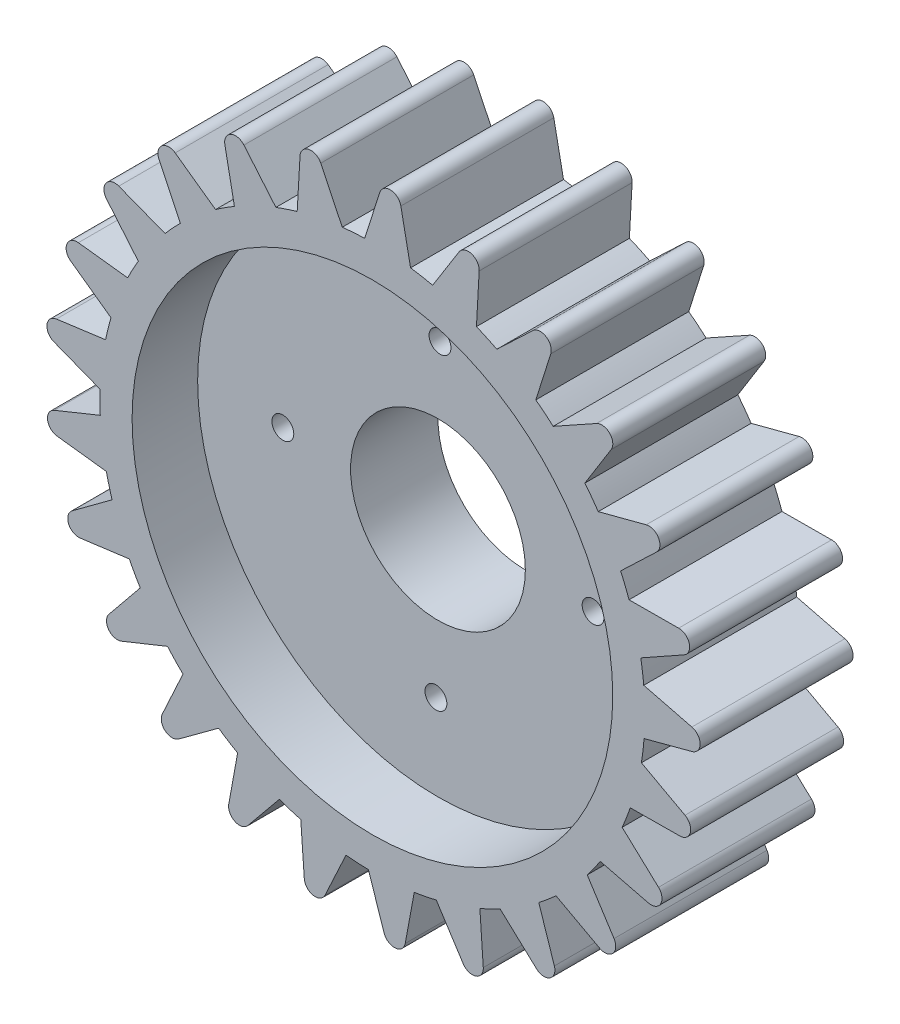
from build123d import *
from build123d.topology import SkipClean

# Parameters (mm, degrees)
BOSS_EXTRU_1_START       = -4.5
BOSS_EXTRU_1_OUTLINE_R   = 0.5
BOSS_EXTRU_1_DEPTH       = 4.5
BOSS_EXTRU_1_START_2     = -7
BOSS_EXTRU_1_2_OUTLINE_R = 10.25
BOSS_EXTRU_1_2_DEPTH     = 2.5
ESQUISSE4_R              = 10.25
BOSS_EXTRU_3_DEPTH       = 3
ESQUISSE5_R              = 11
ENL_V_MAT_EXTRU_2_DEPTH  = 3
ESQUISSE6_R              = 4
ENL_V_MAT_EXTRU_3_DEPTH  = 43.121787281
ESQUISSE7_R              = 0.5
ENL_V_MAT_EXTRU_4_DEPTH  = 43.121787281


with BuildPart() as part:
    # Boss.-Extru.1: read off the stored shape, not the designer's step
    # Boss.-Extru.1 outline → Boss.-Extru.1 (new body)
    with BuildSketch(Plane.XY.offset(81.1).offset(BOSS_EXTRU_1_START)):
        with BuildLine():
            Line((-3.909244984, 5.703911435), (-5.573417888, 7.249599077))
            ThreePointArc((-5.573417888, 7.249599077), (-5.377699975, 7.724704854), (-5.201720804, 8.207470152))
            Line((-5.201720804, 8.207470152), (-2.930536955, 8.226062269))
            ThreePointArc((-2.930536955, 8.226062269), (-2.449499938, 8.605012647), (-2.696157809, 9.16551233))
            Line((-2.696157809, 9.16551233), (-4.692444547, 10.24877638))
            ThreePointArc((-4.692444547, 10.24877638), (-4.621029474, 10.757628902), (-4.570637859, 11.26899148))
            Line((-4.570637859, 11.26899148), (-2.375431099, 11.851819947))
            ThreePointArc((-2.375431099, 11.851819947), (-2.003747871, 12.338493943), (-2.382047135, 12.820043179))
            Line((-2.382047135, 12.820043179), (-4.585013668, 13.372818174))
            ThreePointArc((-4.585013668, 13.372818174), (-4.642388707, 13.883444364), (-4.72075094, 14.391273432))
            Line((-4.72075094, 14.391273432), (-2.739454182, 15.501716992))
            ThreePointArc((-2.739454182, 15.501716992), (-2.500478968, 16.065535089), (-2.986649689, 16.43787637))
            Line((-2.986649689, 16.43787637), (-5.257875529, 16.425429423))
            ThreePointArc((-5.257875529, 16.425429423), (-5.440435595, 16.905744761), (-5.642627888, 17.378131549))
            Line((-5.642627888, 17.378131549), (-3.999733295, 18.94641695))
            ThreePointArc((-3.999733295, 18.94641695), (-3.908481786, 19.551952384), (-4.471976071, 19.791690138))
            Line((-4.471976071, 19.791690138), (-6.668751745, 19.214803336))
            ThreePointArc((-6.668751745, 19.214803336), (-6.965025918, 19.634627842), (-7.278343785, 20.041890553))
            Line((-7.278343785, 20.041890553), (-6.077080467, 21.969476655))
            ThreePointArc((-6.077080467, 21.969476655), (-6.139286329, 22.578681408), (-6.744697761, 22.670752028))
            Line((-6.744697761, 22.670752028), (-8.728991773, 21.565673292))
            ThreePointArc((-8.728991773, 21.565673292), (-9.120364058, 21.898627848), (-9.525120585, 22.215176667))
            Line((-9.525120585, 22.215176667), (-8.840968333, 24.380946146))
            ThreePointArc((-8.840968333, 24.380946146), (-9.052722946, 24.955541642), (-9.662011296, 24.894159994))
            Line((-9.662011296, 24.894159994), (-11.309143157, 23.330325485))
            ThreePointArc((-11.309143157, 23.330325485), (-11.771022192, 23.555489332), (-12.241785039, 23.761434332))
            Line((-12.241785039, 23.761434332), (-12.117731656, 26.029303927))
            ThreePointArc((-12.117731656, 26.029303927), (-12.465729697, 26.533186219), (-13.040611138, 26.322209137))
            Line((-13.040611138, 26.322209137), (-14.247085495, 24.397880327))
            ThreePointArc((-14.247085495, 24.397880327), (-14.750449723, 24.501105593), (-15.257639128, 24.583506493))
            Line((-15.257639128, 24.583506493), (-15.701479344, 26.810977617))
            ThreePointArc((-15.701479344, 26.810977617), (-16.163854817, 27.212485926), (-16.668207433, 26.865169876))
            Line((-16.668207433, 26.865169876), (-17.358217065, 24.701259423))
            ThreePointArc((-17.358217065, 24.701259423), (-17.87143826, 24.676060085), (-18.383185648, 24.629739333))
            Line((-18.383185648, 24.629739333), (-19.367031349, 26.676851782))
            ThreePointArc((-19.367031349, 26.676851782), (-19.914731503, 26.950757865), (-20.316864965, 26.488925992))
            Line((-20.316864965, 26.488925992), (-20.44705403, 24.221400348))
            ThreePointArc((-20.44705403, 24.221400348), (-20.937884616, 24.069359772), (-21.422035016, 23.897227871))
            Line((-21.422035016, 23.897227871), (-22.88406756, 25.635354042))
            ThreePointArc((-22.88406756, 25.635354042), (-23.482678378, 25.764447372), (-23.757325162, 25.217118272))
            Line((-23.757325162, 25.217118272), (-23.319513401, 22.988454411))
            ThreePointArc((-23.319513401, 22.988454411), (-23.757112689, 22.719125866), (-24.183245151, 22.431998497))
            Line((-24.183245151, 22.431998497), (-26.031599654, 23.75192553))
            ThreePointArc((-26.031599654, 23.75192553), (-26.643508219, 23.728094699), (-26.773411257, 23.129659071))
            Line((-26.773411257, 23.129659071), (-25.795107994, 21.079892141))
            ThreePointArc((-25.795107994, 21.079892141), (-26.15198001, 20.71019853), (-26.493319064, 20.326116962))
            Line((-26.493319064, 20.326116962), (-28.611856617, 21.144908987))
            ThreePointArc((-28.611856617, 21.144908987), (-29.198614462, 20.969651373), (-29.175611469, 20.357711129))
            Line((-29.175611469, 20.357711129), (-27.718287094, 18.615635525))
            ThreePointArc((-27.718287094, 18.615635525), (-27.972008257, 18.168806058), (-28.207106316, 17.711903547))
            Line((-28.207106316, 17.711903547), (-30.462711412, 17.97811285))
            ThreePointArc((-30.462711412, 17.97811285), (-30.987450384, 17.662440534), (-30.812986722, 17.07544613))
            Line((-30.812986722, 17.07544613), (-28.968210287, 15.750522868))
            ThreePointArc((-28.968210287, 15.750522868), (-29.102838363, 15.254633483), (-29.21692335, 14.753618895))
            Line((-29.21692335, 14.753618895), (-31.467868026, 14.450518566))
            ThreePointArc((-31.467868026, 14.450518566), (-31.897616846, 14.014266401), (-31.582654708, 13.489100854))
            Line((-31.582654708, 13.489100854), (-29.466340301, 12.664579737))
            ThreePointArc((-29.466340301, 12.664579737), (-29.473416113, 12.150788987), (-29.459319649, 11.637142911))
            Line((-29.459319649, 11.637142911), (-31.564168772, 10.783777859))
            ThreePointArc((-31.564168772, 10.783777859), (-31.871924741, 10.254357173), (-31.436254358, 9.824018565))
            Line((-31.436254358, 9.824018565), (-29.181377796, 9.551707286))
            ThreePointArc((-29.181377796, 9.551707286), (-29.060456745, 9.052298535), (-28.919064562, 8.558295243))
            Line((-28.919064562, 8.558295243), (-30.745562721, 7.208285533))
            ThreePointArc((-30.745562721, 7.208285533), (-30.923950166, 6.651851669), (-30.4528061, 6.30621603))
            ThreePointArc((-30.4528061, 6.30621603), (-30.417820488, 6.307130406), (-30.382984542, 6.310489863))
            Line((-30.382984542, 6.310489863), (-28.131228013, 6.607498741))
            ThreePointArc((-28.131228013, 6.607498741), (-27.889908013, 6.153851677), (-27.630104303, 5.710531213))
            Line((-27.630104303, 5.710531213), (-29.063485901, 3.948702919))
            ThreePointArc((-29.063485901, 3.948702919), (-29.128120108, 3.420421463), (-28.68007066, 3.133174933))
            ThreePointArc((-28.68007066, 3.133174933), (-28.582776383, 3.141853299), (-28.489026078, 3.169282677))
            Line((-28.489026078, 3.169282677), (-26.381875725, 4.016949552))
            ThreePointArc((-26.381875725, 4.016949552), (-26.0353198, 3.637568488), (-25.673428985, 3.272786307))
            Line((-25.673428985, 3.272786307), (-26.623629384, 1.209841581))
            ThreePointArc((-26.623629384, 1.209841581), (-26.591744573, 0.732894494), (-26.173925731, 0.500682133))
            ThreePointArc((-26.173925731, 0.500682133), (-26.015787197, 0.524872616), (-25.873383342, 0.597770608))
            Line((-25.873383342, 0.597770608), (-24.043239171, 1.942833453))
            ThreePointArc((-24.043239171, 1.942833453), (-23.613222703, 1.661556297), (-23.171983715, 1.398233005))
            Line((-23.171983715, 1.398233005), (-23.57929833, -0.83620575))
            ThreePointArc((-23.57929833, -0.83620575), (-23.472770619, -1.244452113), (-23.091841616, -1.425853165))
            ThreePointArc((-23.091841616, -1.425853165), (-22.875282785, -1.378647076), (-22.700406786, -1.242468784))
            Line((-22.700406786, -1.242468784), (-21.262263487, 0.515474786))
            ThreePointArc((-21.262263487, 0.515474786), (-20.775805993, 0.349975216), (-20.282943498, 0.204656383))
            Line((-20.282943498, 0.204656383), (-20.121779254, -2.060878394))
            ThreePointArc((-20.121779254, -2.060878394), (-19.965438701, -2.389765735), (-19.627476996, -2.525379664))
            ThreePointArc((-19.627476996, -2.525379664), (-19.355843148, -2.448017449), (-19.169466196, -2.235806489))
            Line((-19.169466196, -2.235806489), (-18.213687601, -0.175440255))
            ThreePointArc((-18.213687601, -0.175440255), (-17.701354994, -0.214763292), (-17.187837357, -0.232946748))
            Line((-17.187837357, -0.232946748), (-16.468320796, -2.387225667))
            ThreePointArc((-16.468320796, -2.387225667), (-16.288105208, -2.633236988), (-15.998510639, -2.728810069))
            ThreePointArc((-15.998510639, -2.728810069), (-15.676015623, -2.614626788), (-15.502423555, -2.319827447))
            Line((-15.502423555, -2.319827447), (-15.089064749, -0.086498936))
            ThreePointArc((-15.089064749, -0.086498936), (-14.583048771, 0.00282537), (-14.081142194, 0.112919824))
            Line((-14.081142194, 0.112919824), (-12.848483188, -1.794741969))
            ThreePointArc((-12.848483188, -1.794741969), (-12.669554224, -1.961452124), (-12.43296385, -2.0233621))
            ThreePointArc((-12.43296385, -2.0233621), (-12.064623624, -1.866273504), (-11.92969264, -1.489252312))
            Line((-11.92969264, -1.489252312), (-12.084726477, 0.776710232))
            ThreePointArc((-12.084726477, 0.776710232), (-11.616821973, 0.989069307), (-11.158063091, 1.220524032))
            Line((-11.158063091, 1.220524032), (-9.489714138, -0.320655229))
            ThreePointArc((-9.489714138, -0.320655229), (-9.334658071, -0.418206145), (-9.154873045, -0.453361648))
            ThreePointArc((-9.154873045, -0.453361648), (-8.746426575, -0.247960128), (-8.675761274, 0.203730826))
            Line((-8.675761274, 0.203730826), (-9.389446406, 2.359948643))
            ThreePointArc((-9.389446406, 2.359948643), (-8.989053537, 2.681999186), (-8.602267858, 3.020271029))
            Line((-8.602267858, 3.020271029), (-6.603057459, 1.942412262))
            ThreePointArc((-6.603057459, 1.942412262), (-6.490287107, 1.89827398), (-6.370212726, 1.882542386))
            ThreePointArc((-6.370212726, 1.882542386), (-5.928031476, 2.140902511), (-5.94508593, 2.65274561))
            Line((-5.94508593, 2.65274561), (-7.172578897, 4.563735604))
            ThreePointArc((-7.172578897, 4.563735604), (-6.86485582, 4.975241994), (-6.574346511, 5.399076092))
            Line((-6.574346511, 5.399076092), (-4.369892407, 4.852263649))
            ThreePointArc((-4.369892407, 4.852263649), (-4.312353454, 4.841521136), (-4.253953343, 4.83757656))
            ThreePointArc((-4.253953343, 4.83757656), (-3.784940794, 5.152705785), (-3.909244984, 5.703911435))
        make_face()
        with Locations((-17.096499658, 5.136609209)):
            Circle(BOSS_EXTRU_1_OUTLINE_R, mode=Mode.SUBTRACT)
        with BuildLine():
            ThreePointArc((-16.967898566, 16.235841236), (-13.003555219, 12.200499637), (-17.038896818, 8.236156289))
            ThreePointArc((-17.038896818, 8.236156289), (-21.003240165, 12.271497888), (-16.967898566, 16.235841236))
        make_face(mode=Mode.SUBTRACT)
        with Locations((-9.904008139, 12.142896796)):
            Circle(BOSS_EXTRU_1_OUTLINE_R, mode=Mode.SUBTRACT)
        with Locations((-24.102787245, 12.329100728)):
            Circle(BOSS_EXTRU_1_OUTLINE_R, mode=Mode.SUBTRACT)
        with Locations((-16.910295726, 19.335388315)):
            Circle(BOSS_EXTRU_1_OUTLINE_R, mode=Mode.SUBTRACT)
    extrude(amount=BOSS_EXTRU_1_DEPTH)

    # Boss.-Extru.1 2 outline → Boss.-Extru.1 2 (add)
    with BuildSketch(Plane.XY.offset(81.1).offset(BOSS_EXTRU_1_START_2)):
        with BuildLine():
            Line((-3.909244984, 5.703911435), (-5.573417888, 7.249599077))
            ThreePointArc((-5.573417888, 7.249599077), (-5.377699975, 7.724704854), (-5.201720804, 8.207470152))
            Line((-5.201720804, 8.207470152), (-2.930536955, 8.226062269))
            ThreePointArc((-2.930536955, 8.226062269), (-2.449499938, 8.605012647), (-2.696157809, 9.16551233))
            Line((-2.696157809, 9.16551233), (-4.692444547, 10.24877638))
            ThreePointArc((-4.692444547, 10.24877638), (-4.621029474, 10.757628902), (-4.570637859, 11.26899148))
            Line((-4.570637859, 11.26899148), (-2.375431099, 11.851819947))
            ThreePointArc((-2.375431099, 11.851819947), (-2.003747871, 12.338493943), (-2.382047135, 12.820043179))
            Line((-2.382047135, 12.820043179), (-4.585013668, 13.372818174))
            ThreePointArc((-4.585013668, 13.372818174), (-4.642388707, 13.883444364), (-4.72075094, 14.391273432))
            Line((-4.72075094, 14.391273432), (-2.739454182, 15.501716992))
            ThreePointArc((-2.739454182, 15.501716992), (-2.500478968, 16.065535089), (-2.986649689, 16.43787637))
            Line((-2.986649689, 16.43787637), (-5.257875529, 16.425429423))
            ThreePointArc((-5.257875529, 16.425429423), (-5.440435595, 16.905744761), (-5.642627888, 17.378131549))
            Line((-5.642627888, 17.378131549), (-3.999733295, 18.94641695))
            ThreePointArc((-3.999733295, 18.94641695), (-3.908481786, 19.551952384), (-4.471976071, 19.791690138))
            Line((-4.471976071, 19.791690138), (-6.668751745, 19.214803336))
            ThreePointArc((-6.668751745, 19.214803336), (-6.965025918, 19.634627842), (-7.278343785, 20.041890553))
            Line((-7.278343785, 20.041890553), (-6.077080467, 21.969476655))
            ThreePointArc((-6.077080467, 21.969476655), (-6.139286329, 22.578681408), (-6.744697761, 22.670752028))
            Line((-6.744697761, 22.670752028), (-8.728991773, 21.565673292))
            ThreePointArc((-8.728991773, 21.565673292), (-9.120364058, 21.898627848), (-9.525120585, 22.215176667))
            Line((-9.525120585, 22.215176667), (-8.840968333, 24.380946146))
            ThreePointArc((-8.840968333, 24.380946146), (-9.052722946, 24.955541642), (-9.662011296, 24.894159994))
            Line((-9.662011296, 24.894159994), (-11.309143157, 23.330325485))
            ThreePointArc((-11.309143157, 23.330325485), (-11.771022192, 23.555489332), (-12.241785039, 23.761434332))
            Line((-12.241785039, 23.761434332), (-12.117731656, 26.029303927))
            ThreePointArc((-12.117731656, 26.029303927), (-12.465729697, 26.533186219), (-13.040611138, 26.322209137))
            Line((-13.040611138, 26.322209137), (-14.247085495, 24.397880327))
            ThreePointArc((-14.247085495, 24.397880327), (-14.750449723, 24.501105593), (-15.257639128, 24.583506493))
            Line((-15.257639128, 24.583506493), (-15.701479344, 26.810977617))
            ThreePointArc((-15.701479344, 26.810977617), (-16.163854817, 27.212485926), (-16.668207433, 26.865169876))
            Line((-16.668207433, 26.865169876), (-17.358217065, 24.701259423))
            ThreePointArc((-17.358217065, 24.701259423), (-17.87143826, 24.676060085), (-18.383185648, 24.629739333))
            Line((-18.383185648, 24.629739333), (-19.367031349, 26.676851782))
            ThreePointArc((-19.367031349, 26.676851782), (-19.914731503, 26.950757865), (-20.316864965, 26.488925992))
            Line((-20.316864965, 26.488925992), (-20.44705403, 24.221400348))
            ThreePointArc((-20.44705403, 24.221400348), (-20.937884616, 24.069359772), (-21.422035016, 23.897227871))
            Line((-21.422035016, 23.897227871), (-22.88406756, 25.635354042))
            ThreePointArc((-22.88406756, 25.635354042), (-23.482678378, 25.764447372), (-23.757325162, 25.217118272))
            Line((-23.757325162, 25.217118272), (-23.319513401, 22.988454411))
            ThreePointArc((-23.319513401, 22.988454411), (-23.757112689, 22.719125866), (-24.183245151, 22.431998497))
            Line((-24.183245151, 22.431998497), (-26.031599654, 23.75192553))
            ThreePointArc((-26.031599654, 23.75192553), (-26.643508219, 23.728094699), (-26.773411257, 23.129659071))
            Line((-26.773411257, 23.129659071), (-25.795107994, 21.079892141))
            ThreePointArc((-25.795107994, 21.079892141), (-26.15198001, 20.71019853), (-26.493319064, 20.326116962))
            Line((-26.493319064, 20.326116962), (-28.611856617, 21.144908987))
            ThreePointArc((-28.611856617, 21.144908987), (-29.198614462, 20.969651373), (-29.175611469, 20.357711129))
            Line((-29.175611469, 20.357711129), (-27.718287094, 18.615635525))
            ThreePointArc((-27.718287094, 18.615635525), (-27.972008257, 18.168806058), (-28.207106316, 17.711903547))
            Line((-28.207106316, 17.711903547), (-30.462711412, 17.97811285))
            ThreePointArc((-30.462711412, 17.97811285), (-30.987450384, 17.662440534), (-30.812986722, 17.07544613))
            Line((-30.812986722, 17.07544613), (-28.968210287, 15.750522868))
            ThreePointArc((-28.968210287, 15.750522868), (-29.102838363, 15.254633483), (-29.21692335, 14.753618895))
            Line((-29.21692335, 14.753618895), (-31.467868026, 14.450518566))
            ThreePointArc((-31.467868026, 14.450518566), (-31.897616846, 14.014266401), (-31.582654708, 13.489100854))
            Line((-31.582654708, 13.489100854), (-29.466340301, 12.664579737))
            ThreePointArc((-29.466340301, 12.664579737), (-29.473416113, 12.150788987), (-29.459319649, 11.637142911))
            Line((-29.459319649, 11.637142911), (-31.564168772, 10.783777859))
            ThreePointArc((-31.564168772, 10.783777859), (-31.871924741, 10.254357173), (-31.436254358, 9.824018565))
            Line((-31.436254358, 9.824018565), (-29.181377796, 9.551707286))
            ThreePointArc((-29.181377796, 9.551707286), (-29.060456745, 9.052298535), (-28.919064562, 8.558295243))
            Line((-28.919064562, 8.558295243), (-30.745562721, 7.208285533))
            ThreePointArc((-30.745562721, 7.208285533), (-30.923950166, 6.651851669), (-30.4528061, 6.30621603))
            ThreePointArc((-30.4528061, 6.30621603), (-30.417820488, 6.307130406), (-30.382984542, 6.310489863))
            Line((-30.382984542, 6.310489863), (-28.131228013, 6.607498741))
            ThreePointArc((-28.131228013, 6.607498741), (-27.889908013, 6.153851677), (-27.630104303, 5.710531213))
            Line((-27.630104303, 5.710531213), (-29.063485901, 3.948702919))
            ThreePointArc((-29.063485901, 3.948702919), (-29.128120108, 3.420421463), (-28.68007066, 3.133174933))
            ThreePointArc((-28.68007066, 3.133174933), (-28.582776383, 3.141853299), (-28.489026078, 3.169282677))
            Line((-28.489026078, 3.169282677), (-26.381875725, 4.016949552))
            ThreePointArc((-26.381875725, 4.016949552), (-26.0353198, 3.637568488), (-25.673428985, 3.272786307))
            Line((-25.673428985, 3.272786307), (-26.623629384, 1.209841581))
            ThreePointArc((-26.623629384, 1.209841581), (-26.591744573, 0.732894494), (-26.173925731, 0.500682133))
            ThreePointArc((-26.173925731, 0.500682133), (-26.015787197, 0.524872616), (-25.873383342, 0.597770608))
            Line((-25.873383342, 0.597770608), (-24.043239171, 1.942833453))
            ThreePointArc((-24.043239171, 1.942833453), (-23.613222703, 1.661556297), (-23.171983715, 1.398233005))
            Line((-23.171983715, 1.398233005), (-23.57929833, -0.83620575))
            ThreePointArc((-23.57929833, -0.83620575), (-23.472770619, -1.244452113), (-23.091841616, -1.425853165))
            ThreePointArc((-23.091841616, -1.425853165), (-22.875282785, -1.378647076), (-22.700406786, -1.242468784))
            Line((-22.700406786, -1.242468784), (-21.262263487, 0.515474786))
            ThreePointArc((-21.262263487, 0.515474786), (-20.775805993, 0.349975216), (-20.282943498, 0.204656383))
            Line((-20.282943498, 0.204656383), (-20.121779254, -2.060878394))
            ThreePointArc((-20.121779254, -2.060878394), (-19.965438701, -2.389765735), (-19.627476996, -2.525379664))
            ThreePointArc((-19.627476996, -2.525379664), (-19.355843148, -2.448017449), (-19.169466196, -2.235806489))
            Line((-19.169466196, -2.235806489), (-18.213687601, -0.175440255))
            ThreePointArc((-18.213687601, -0.175440255), (-17.701354994, -0.214763292), (-17.187837357, -0.232946748))
            Line((-17.187837357, -0.232946748), (-16.468320796, -2.387225667))
            ThreePointArc((-16.468320796, -2.387225667), (-16.288105208, -2.633236988), (-15.998510639, -2.728810069))
            ThreePointArc((-15.998510639, -2.728810069), (-15.676015623, -2.614626788), (-15.502423555, -2.319827447))
            Line((-15.502423555, -2.319827447), (-15.089064749, -0.086498936))
            ThreePointArc((-15.089064749, -0.086498936), (-14.583048771, 0.00282537), (-14.081142194, 0.112919824))
            Line((-14.081142194, 0.112919824), (-12.848483188, -1.794741969))
            ThreePointArc((-12.848483188, -1.794741969), (-12.669554224, -1.961452124), (-12.43296385, -2.0233621))
            ThreePointArc((-12.43296385, -2.0233621), (-12.064623624, -1.866273504), (-11.92969264, -1.489252312))
            Line((-11.92969264, -1.489252312), (-12.084726477, 0.776710232))
            ThreePointArc((-12.084726477, 0.776710232), (-11.616821973, 0.989069307), (-11.158063091, 1.220524032))
            Line((-11.158063091, 1.220524032), (-9.489714138, -0.320655229))
            ThreePointArc((-9.489714138, -0.320655229), (-9.334658071, -0.418206145), (-9.154873045, -0.453361648))
            ThreePointArc((-9.154873045, -0.453361648), (-8.746426575, -0.247960128), (-8.675761274, 0.203730826))
            Line((-8.675761274, 0.203730826), (-9.389446406, 2.359948643))
            ThreePointArc((-9.389446406, 2.359948643), (-8.989053537, 2.681999186), (-8.602267858, 3.020271029))
            Line((-8.602267858, 3.020271029), (-6.603057459, 1.942412262))
            ThreePointArc((-6.603057459, 1.942412262), (-6.490287107, 1.89827398), (-6.370212726, 1.882542386))
            ThreePointArc((-6.370212726, 1.882542386), (-5.928031476, 2.140902511), (-5.94508593, 2.65274561))
            Line((-5.94508593, 2.65274561), (-7.172578897, 4.563735604))
            ThreePointArc((-7.172578897, 4.563735604), (-6.86485582, 4.975241994), (-6.574346511, 5.399076092))
            Line((-6.574346511, 5.399076092), (-4.369892407, 4.852263649))
            ThreePointArc((-4.369892407, 4.852263649), (-4.312353454, 4.841521136), (-4.253953343, 4.83757656))
            ThreePointArc((-4.253953343, 4.83757656), (-3.784940794, 5.152705785), (-3.909244984, 5.703911435))
        make_face()
        with Locations((-17.003397692, 12.235998762)):
            Circle(BOSS_EXTRU_1_2_OUTLINE_R, mode=Mode.SUBTRACT)
    extrude(amount=BOSS_EXTRU_1_2_DEPTH)

    # Esquisse4 → Boss.-Extru.3 (add)
    with BuildSketch(Plane(origin=(0, 0, 74.1), x_dir=(-1, 0, 0), z_dir=(0, 0, -1))):
        with Locations((17.003397692, 12.235998762)):
            Circle(ESQUISSE4_R)
    extrude(amount=-BOSS_EXTRU_3_DEPTH)

    # Esquisse5 → Enlèv. mat.-Extru.2 (cut)
    with BuildSketch(Plane.XY.offset(81.1)):
        with Locations((-17.003397692, 12.235998762)):
            Circle(ESQUISSE5_R)
    extrude(amount=-ENL_V_MAT_EXTRU_2_DEPTH, mode=Mode.SUBTRACT)

    # Esquisse6 → Enlèv. mat.-Extru.3 (cut, through all)
    with SkipClean():  # the faces are left unmerged after this step: merging them gives an invalid solid
        with BuildSketch(Plane.XY.offset(78.1)):
            with Locations((-17.003397692, 12.235998762)):
                Circle(ESQUISSE6_R)
        extrude(amount=-ENL_V_MAT_EXTRU_3_DEPTH, mode=Mode.SUBTRACT)

    # Esquisse7 → Enlèv. mat.-Extru.4 (cut, through all)
    with SkipClean():  # the faces are left unmerged after this step: merging them gives an invalid solid
        with BuildSketch(Plane.XY.offset(78.1)):
            with Locations((-24.102787245, 12.329100728)):
                Circle(ESQUISSE7_R)
            with Locations((-16.910295726, 19.335388315)):
                Circle(ESQUISSE7_R)
            with Locations((-9.904008139, 12.142896796)):
                Circle(ESQUISSE7_R)
            with Locations((-17.096499658, 5.136609209)):
                Circle(ESQUISSE7_R)
        extrude(amount=-ENL_V_MAT_EXTRU_4_DEPTH, mode=Mode.SUBTRACT)


solid = part.part
